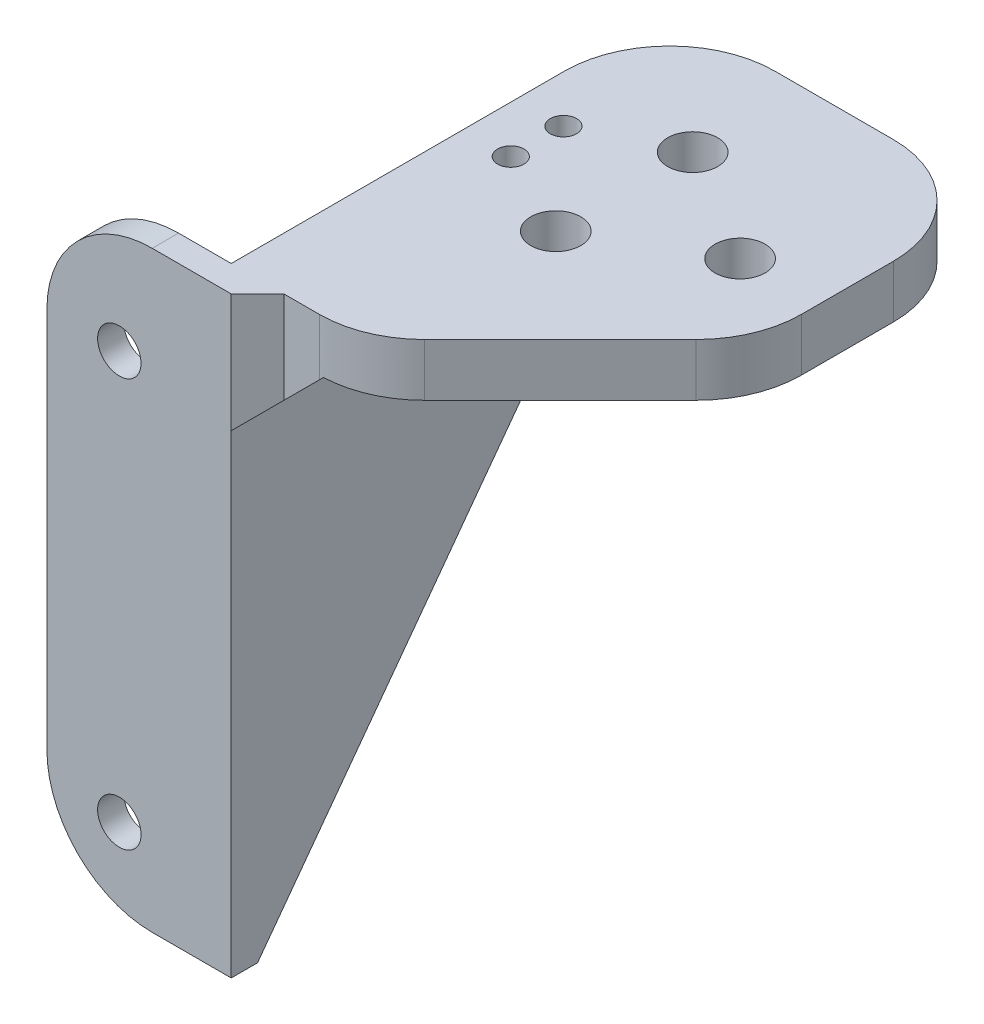
from build123d import *

# Parameters (mm, degrees)
SKETCH1_R           = 1.6500000000000001
SKETCH1_R_2         = 1.6500000000000006
BOSS_EXTRUDE1_DEPTH = 2
BOSS_EXTRUDE2_DEPTH = 2
BOSS_EXTRUDE3_DEPTH = 4
SKETCH4_R           = 1.8999999999999948
SKETCH4_R_2         = 1.8999999999999964
SKETCH4_R_3         = 1.8999999999999981
CUT_EXTRUDE1_DEPTH  = 4
SKETCH5_R           = 1.0000000000000009
SKETCH5_R_2         = 1
SKETCH5_R_3         = 1.8999999999999981
CUT_EXTRUDE2_DEPTH  = 63.418667079648536
CUT_EXTRUDE3_DEPTH  = 4
CHAMFER1_SIZE       = 5
CHAMFER2_SIZE       = 2
FILLET1_R           = 8
FILLET2_R           = 8
FILLET3_R           = 8


# Some blends are built 0.0001 mm under size
with BuildPart() as part:
    # Sketch1 → Boss-Extrude1 (new body)
    with BuildSketch(Plane.XY):
        Polygon((0, 0), (-12, -1.47e-15), (-12, 45), (0, 45), align=None)
        with Locations((-6.499999999999999, 37)):
            Circle(SKETCH1_R, mode=Mode.SUBTRACT)
        with Locations((-6.5000000000000036, 5.999999999999999)):
            Circle(SKETCH1_R_2, mode=Mode.SUBTRACT)
    extrude(amount=-BOSS_EXTRUDE1_DEPTH)

    # Sketch2 → Boss-Extrude2 (add)
    with BuildSketch(Plane(origin=(0, 0, 0), x_dir=(0, 0, -1), z_dir=(1, 0, 0))):
        Polygon((35.3, 45), (2, 0), (5.51e-15, 0), (0, 45), align=None)
    extrude(amount=BOSS_EXTRUDE2_DEPTH)

    # Sketch3 → Boss-Extrude3 (add)
    with BuildSketch(Plane(origin=(0, 45, 0), x_dir=(1, 0, 0), z_dir=(0, 1, 0))):
        Polygon((-6.1e-16, 35.3), (25, 35.3), (25.000000000000004, 1.9999999999999991), (3.47e-15, 1.9999999999999991), align=None)
    extrude(amount=-BOSS_EXTRUDE3_DEPTH)

    # Sketch4 → Cut-Extrude1 (cut)
    with BuildSketch(Plane(origin=(0, 45, 0), x_dir=(1, 0, 0), z_dir=(0, 1, 0))):
        with Locations(Location((10.199999999999998, 26.849999999999998, 0), (0, 0, 270))):
            Circle(SKETCH4_R)
        with Locations(Location((10.2, 16.45, 0), (0, 0, 270))):
            Circle(SKETCH4_R_2)
        with Locations(Location((18.999999999999996, 21.65, 0), (0, 0, 270))):
            Circle(SKETCH4_R_3)
    extrude(amount=-CUT_EXTRUDE1_DEPTH, mode=Mode.SUBTRACT)

    # Sketch5 → Cut-Extrude2 (cut, through all)
    with BuildSketch(Plane(origin=(0, 45, 0), x_dir=(1, 0, 0), z_dir=(0, 1, 0))):
        with Locations(Location((3.5826389249908894, 23.65, 0), (0, 0, 270))):
            Circle(SKETCH5_R)
        with Locations(Location((3.5826389249908894, 19.650000000000002, 0), (0, 0, 270))):
            Circle(SKETCH5_R_2)
        with Locations(Location((18.999999999999996, 21.65, 0), (0, 0, 270))):
            Circle(SKETCH5_R_3)
    extrude(amount=-CUT_EXTRUDE2_DEPTH, mode=Mode.SUBTRACT)

    # Sketch6 → Cut-Extrude3 (cut)
    with BuildSketch(Plane(origin=(0, 45, 0), x_dir=(1, 0, 0), z_dir=(0, 1, 0))):
        Polygon((10.000000000000005, 1.9999999999999991), (25.000000000000004, 16.99999999999984), (25.000000000000004, 1.9999999999999991), align=None)
    extrude(amount=-CUT_EXTRUDE3_DEPTH, mode=Mode.SUBTRACT)

    # Chamfer1
    # the kernel refuses this chamfer: 5 mm, written as the material it adds along each edge
    with BuildSketch(Plane(origin=(2, 41, -45.19841493982955), x_dir=(-0.02749587661058636, -0.9996219169112968, 0), z_dir=(0, 0, 1))) as chamfer1_piece_1_section:
        Polygon((CHAMFER1_SIZE * 0.999621916911, CHAMFER1_SIZE * 0.0274958766106), (-CHAMFER1_SIZE * 0.0274958766106, CHAMFER1_SIZE * 0.999621916911), (0, 0), align=None)
    chamfer1_piece_1 = extrude(amount=43.19841493982955, mode=Mode.PRIVATE)
    chamfer1_piece_1 = split(chamfer1_piece_1, bisect_by=Plane(origin=(3.679771833975431, 32.284665683470884, -25.89065260576845), z_dir=(0, 0.5948430054102947, 0.8038418992031009)), keep=Keep.TOP, mode=Mode.PRIVATE)
    chamfer1_piece_1 = chamfer1_piece_1 - Plane(origin=(3.5826389249908894, 39.396771086693036, -19.650000000000002), x_dir=(-1.8e-16, 0, 1), z_dir=(0, 1, 0)) * Cylinder(1, 107, mode=Mode.PRIVATE)
    chamfer1_piece_1 = chamfer1_piece_1 - Plane(origin=(3.5826389249908894, 39.396771086693036, -23.65), x_dir=(-1.8e-16, 0, 1), z_dir=(0, 1, 0)) * Cylinder(1.0000000000000009, 107, mode=Mode.PRIVATE)
    add(chamfer1_piece_1)

    # Chamfer2
    chamfer2_edges = [part.edges().sort_by_distance(p)[0] for p in [
        (1.9999999999990004, 40.50000000000074, -1.9999999999999996),
    ]]
    chamfer(chamfer2_edges, length=CHAMFER2_SIZE - 0.0001)  # a hair under: the kernel refuses the full size

    # Fillet1
    fillet1_edges = [part.edges().sort_by_distance(p)[0] for p in [
        (-12, -1.47e-15, -1),
        (-12, 45, -1),
    ]]
    fillet(fillet1_edges, radius=FILLET1_R)

    # Fillet2
    fillet2_edges = [part.edges().sort_by_distance(p)[0] for p in [
        (-6.1e-16, 43, -35.3),
        (25, 43, -35.3),
    ]]
    fillet(fillet2_edges, radius=FILLET2_R)

    # Fillet3
    fillet3_edges = [part.edges().sort_by_distance(p)[0] for p in [
        (10.000000000000005, 43, -1.9999999999999991),
        (25.000000000000004, 43, -16.99999999999984),
    ]]
    fillet(fillet3_edges, radius=FILLET3_R)


solid = part.part
